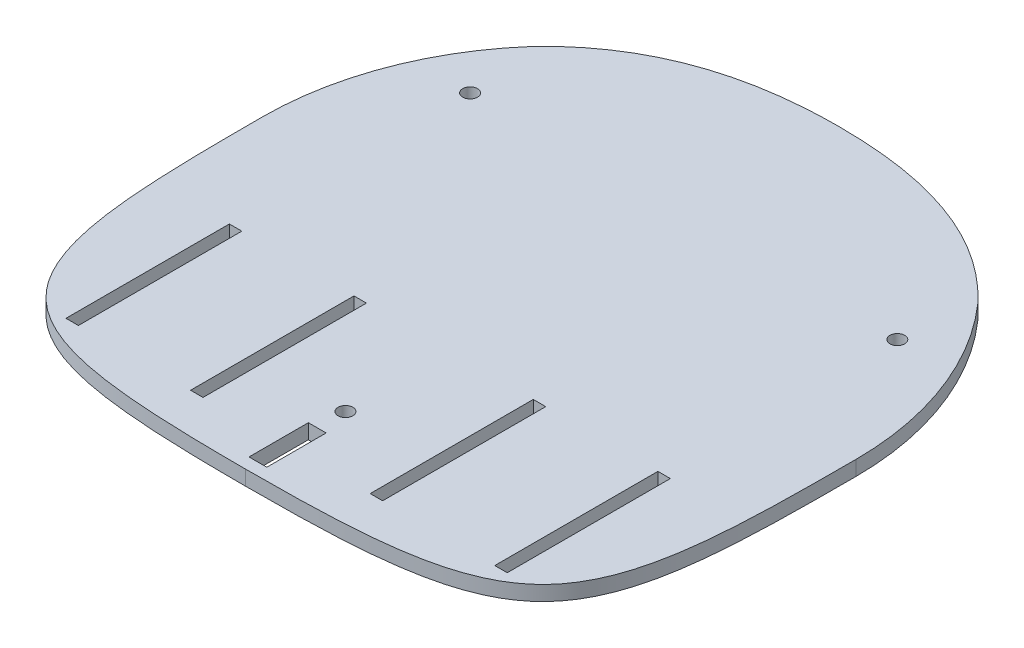
from build123d import *

# Parameters (mm, degrees)
BASE_DEPTH           = 6.35
EMPTYSPACETRIM_DEPTH = 185.858976792
SKETCH8_W            = 5.334
SKETCH8_H            = 69.954
SKETCH8_W_2          = 7.62
SKETCH8_H_2          = 25.4
SKETCH8_H_3          = 69.827
MOTORCUT_DEPTH       = 185.858976792
SKETCH11_R           = 3.175
SCREWCUT_DEPTH       = 185.858976792


with BuildPart() as part:
    # Sketch1 → Base (new body)
    with BuildSketch(Plane(origin=(0, 0, 0), x_dir=(1, 0, 0), z_dir=(0, 1, 0))):
        with BuildLine():
            ThreePointArc((127, 0), (0, 127), (-127, 0))
            add(Edge.make_bspline(
                [(-127, 0), (-127, -50.624671912), (-125.847104384, -127.403215469), (-59.089145197, -134.177191606), (0, -134.177191606)],
                knots=[0, 0, 0, 0, 0.496988082, 1, 1, 1, 1], degree=3))
            add(Edge.make_bspline(
                [(127, 0), (127, -50.624671912), (125.847104384, -127.403215469), (59.089145197, -134.177191606), (0, -134.177191606)],
                knots=[0, 0, 0, 0, 0.496988082, 1, 1, 1, 1], degree=3))
        make_face()
    extrude(amount=BASE_DEPTH)

    # Sketch16 → EmptySpaceTrim (cut, through all)
    with BuildSketch(Plane(origin=(0, 6.35, 0), x_dir=(1, 0, 0), z_dir=(0, 1, 0))):
        with BuildLine():
            Line((-95.26964052, 133.35), (-95.26964052, 83.980328621))
            add(Edge.make_bspline(
                [(-95.26964052, 83.980328621), (-69.156047903, 111.711202419), (-34.972901221, 119.822808394), (0, 119.822808394)],
                knots=[0, 0, 0, 0, 1, 1, 1, 1], degree=3))
            add(Edge.make_bspline(
                [(95.26964052, 83.980328621), (69.156047903, 111.711202419), (34.972901221, 119.822808394), (0, 119.822808394)],
                knots=[0, 0, 0, 0, 1, 1, 1, 1], degree=3))
            Line((95.26964052, 83.980328621), (95.26964052, 133.35))
            Line((95.26964052, 133.35), (-95.26964052, 133.35))
        make_face()
    extrude(amount=-EMPTYSPACETRIM_DEPTH, mode=Mode.SUBTRACT)

    # Sketch8 → MotorCut (cut, through all)
    with BuildSketch(Plane(origin=(0, 6.35, 0), x_dir=(1, 0, 0), z_dir=(0, 1, 0))):
        with Locations((-38.378348141, -81.74)):
            Rectangle(SKETCH8_W, SKETCH8_H)
        with Locations((0, -116.230204152)):
            Rectangle(SKETCH8_W_2, SKETCH8_H_2)
        with Locations((-91.718348141, -81.74)):
            Rectangle(SKETCH8_W, SKETCH8_H)
        with Locations((91.718348141, -81.6765)):
            Rectangle(SKETCH8_W, SKETCH8_H_3)
        with Locations((38.378348141, -81.6765)):
            Rectangle(SKETCH8_W, SKETCH8_H_3)
    extrude(amount=-MOTORCUT_DEPTH, mode=Mode.SUBTRACT)

    # Sketch11 → ScrewCut (cut, through all)
    with BuildSketch(Plane(origin=(0, 6.35, 0), x_dir=(1, 0, 0), z_dir=(0, 1, 0))):
        with Locations((0, -91.44)):
            Circle(SKETCH11_R)
        with Locations((-91.44, 53.34)):
            Circle(SKETCH11_R)
        with Locations((91.44, 53.34)):
            Circle(SKETCH11_R)
    extrude(amount=-SCREWCUT_DEPTH, mode=Mode.SUBTRACT)


solid = part.part
